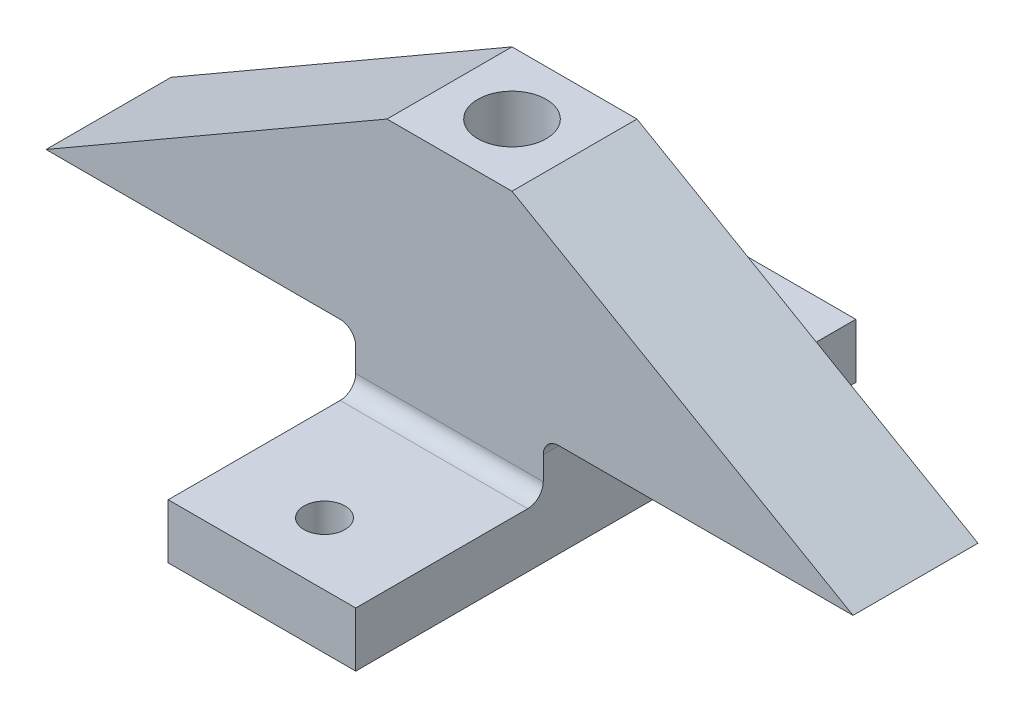
from build123d import *

# Parameters (mm, degrees)
BOSS_EXTRUDE1_DEPTH        = 25.4
SKETCH2_W                  = 38.1
SKETCH2_H                  = 11.1125
BOSS_EXTRUDE2_DEPTH        = 38.1
SKETCH3_W                  = 38.1
SKETCH3_H                  = 11.1125
BOSS_EXTRUDE3_DEPTH        = 38.1
F_0_328IN_DOWEL_HOLE1_D    = 8.3312
F_0_55IN_DOWEL_HOLE2_D     = 13.8938
F_0_55IN_DOWEL_HOLE2_DEPTH = 35.052
F_0_55IN_DOWEL_HOLE2_TIP   = 4.174118634
FILLET1_R                  = 3.175


with BuildPart() as part:
    # Sketch1 → Boss-Extrude1 (new body)
    with BuildSketch(Plane.XY):
        Polygon((0, 0), (0, 22.225), (-62.932032303, 22.225), (6.35, 62.225), (31.75, 62.225), (101.032032303, 22.225), (38.1, 22.225), (38.1, 0), align=None)
    extrude(amount=BOSS_EXTRUDE1_DEPTH)

    # Sketch2 → Boss-Extrude2 (add)
    with BuildSketch(Plane.XY.offset(25.4)):
        with Locations((19.05, 5.55625)):
            Rectangle(SKETCH2_W, SKETCH2_H)
    extrude(amount=BOSS_EXTRUDE2_DEPTH)

    # Sketch3 → Boss-Extrude3 (add)
    with BuildSketch(Plane(origin=(0, 0, 0), x_dir=(-1, 0, 0), z_dir=(0, 0, -1))):
        with Locations((-19.05, 5.55625)):
            Rectangle(SKETCH3_W, SKETCH3_H)
    extrude(amount=BOSS_EXTRUDE3_DEPTH)

    # Ø0.328in Dowel Hole1 (through all)
    with Locations(Plane(origin=(0, 11.1125, 0), x_dir=(1, 0, 0), z_dir=(0, 1, 0))):
        with Locations((19.05, 25.4), (19.05, -50.8)):
            Hole(F_0_328IN_DOWEL_HOLE1_D / 2)

    # Ø0.55in Dowel Hole2
    with Locations(Plane(origin=(0, 62.225, 0), x_dir=(1, 0, 0), z_dir=(0, 1, 0))):
        with Locations((19.05, -12.7)):
            Hole(F_0_55IN_DOWEL_HOLE2_D / 2, depth=F_0_55IN_DOWEL_HOLE2_DEPTH)
            with Locations((0, 0, -(F_0_55IN_DOWEL_HOLE2_DEPTH + F_0_55IN_DOWEL_HOLE2_TIP / 2))):  # 118° drill point
                Cone(0, F_0_55IN_DOWEL_HOLE2_D / 2, F_0_55IN_DOWEL_HOLE2_TIP, mode=Mode.SUBTRACT)

    # Fillet1
    fillet1_edges = [part.edges().sort_by_distance(p)[0] for p in [
        (38.1, 22.225, 12.7),
        (19.05, 11.1125, 0),
        (0, 22.225, 12.7),
        (19.05, 11.1125, 25.4),
    ]]
    fillet(fillet1_edges, radius=FILLET1_R)


solid = part.part
